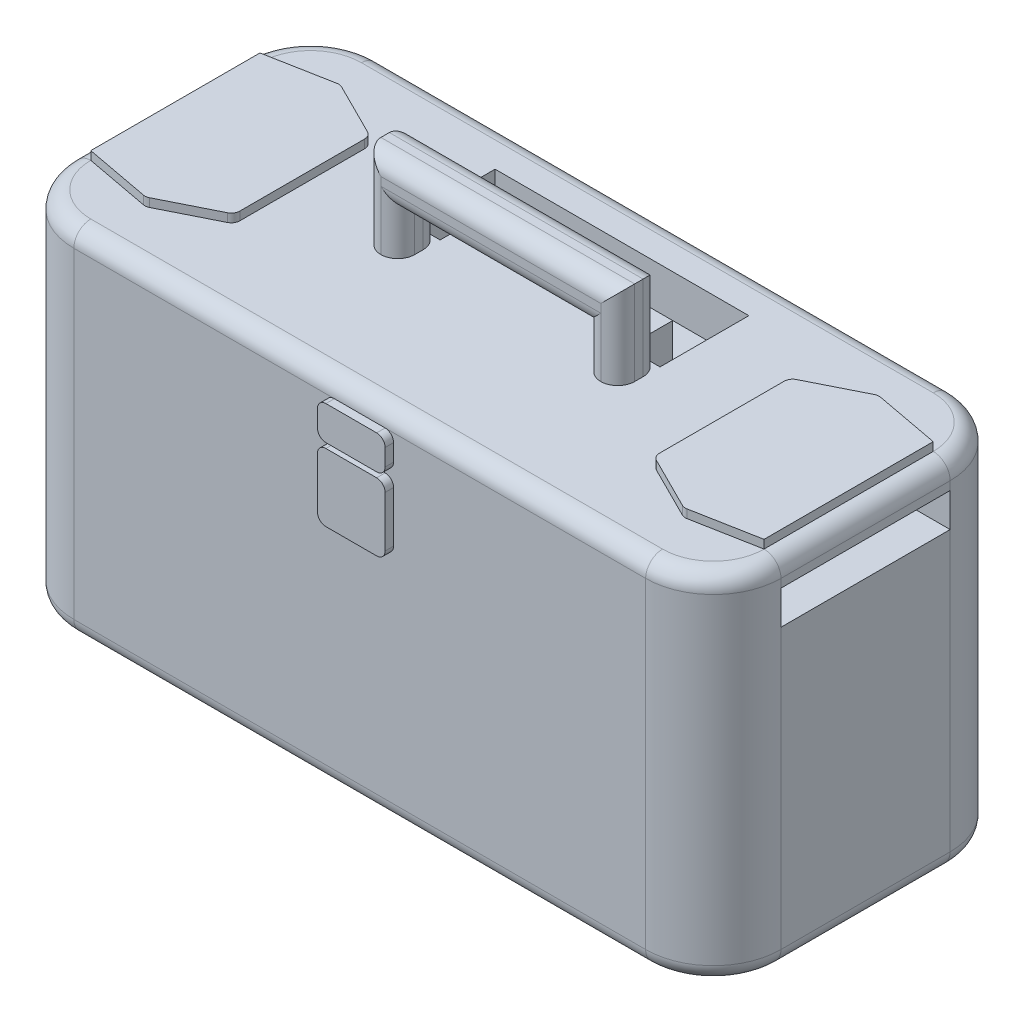
from build123d import *

# Parameters (mm, degrees)
SKIZZE1_W                       = 418
SKIZZE1_H                       = 210
AUFSATZ_LINEAR_AUSTRAGEN1_DEPTH = 90
VERRUNDUNG1_R                   = 40
SCHNITT_LINEAR_AUSTRAGEN1_DEPTH = 25
AUFSATZ_LINEAR_AUSTRAGEN2_DEPTH = 12.5
VERRUNDUNG2_R                   = 10
SKIZZE5_W                       = 100
SKIZZE5_H                       = 20
SCHNITT_LINEAR_AUSTRAGEN2_DEPTH = 20
SKIZZE6_W                       = 100
SKIZZE6_H                       = 20
SCHNITT_LINEAR_AUSTRAGEN3_DEPTH = 20
VERRUNDUNG4_R                   = 10
AUFSATZ_LINEAR_AUSTRAGEN3_DEPTH = 5
AUFSATZ_LINEAR_AUSTRAGEN4_DEPTH = 5


with BuildPart() as part:
    # Skizze1 → Aufsatz-Linear austragen1 (new, symmetric)
    with BuildSketch(Plane.XY):
        with Locations((0, 105)):
            Rectangle(SKIZZE1_W, SKIZZE1_H)
    extrude(amount=AUFSATZ_LINEAR_AUSTRAGEN1_DEPTH, both=True)

    # Verrundung1
    verrundung1_edges = [part.edges().sort_by_distance(p)[0] for p in [
        (209, 105, 90),
        (-209, 105, 90),
        (209, 105, -90),
        (-209, 105, -90),
    ]]
    fillet(verrundung1_edges, radius=VERRUNDUNG1_R)

    # Skizze3 → Schnitt-Linear austragen1 (cut)
    with BuildSketch(Plane(origin=(0, 210, 0), x_dir=(1, 0, 0), z_dir=(0, 1, 0))):
        Polygon((-75, -10), (-75, 65), (75, 65), (75, -10), (55, -10), (55, 40), (-55, 40), (-55, -10), align=None)
    extrude(amount=-SCHNITT_LINEAR_AUSTRAGEN1_DEPTH, mode=Mode.SUBTRACT)

    # Skizze4 → Aufsatz-Linear austragen2 (add, symmetric)
    with BuildSketch(Plane.XY):
        Polygon((-75, 185), (-75, 260), (75, 260), (75, 185), (55, 185), (55, 235), (-55, 235), (-55, 185), align=None)
    extrude(amount=AUFSATZ_LINEAR_AUSTRAGEN2_DEPTH, both=True)

    # Verrundung2
    verrundung2_edges = [part.edges().sort_by_distance(p)[0] for p in [
        (-75, 235, -12.5),
        (-55, 222.5, -12.5),
        (55, 222.5, -12.5),
        (0, 235, -12.5),
        (0, 260, -12.5),
        (75, 235, -12.5),
        (75, 235, 12.5),
        (55, 222.5, 12.5),
        (0, 260, 12.5),
        (0, 235, 12.5),
        (-55, 222.5, 12.5),
        (-75, 235, 12.5),
    ]]
    fillet(verrundung2_edges, radius=VERRUNDUNG2_R - 0.0001)  # a hair under: the kernel refuses the full size

    # Skizze5 → Schnitt-Linear austragen2 (cut)
    with BuildSketch(Plane(origin=(209, 0, 0), x_dir=(0, 0, -1), z_dir=(1, 0, 0))):
        with Locations((0, 185)):
            Rectangle(SKIZZE5_W, SKIZZE5_H)
    extrude(amount=-SCHNITT_LINEAR_AUSTRAGEN2_DEPTH, mode=Mode.SUBTRACT)

    # Skizze6 → Schnitt-Linear austragen3 (cut)
    with BuildSketch(Plane.ZY.offset(209)):
        with Locations((0, 185)):
            Rectangle(SKIZZE6_W, SKIZZE6_H)
    extrude(amount=-SCHNITT_LINEAR_AUSTRAGEN3_DEPTH, mode=Mode.SUBTRACT)

    # Verrundung4
    verrundung4_edges = [part.edges().sort_by_distance(p)[0] for p in [
        (0, 0, 90),
        (0, 210, 90),
        (0, 210, -90),
        (-209, 210, 0),
        (209, 210, 0),
        (-197.284271247, 210, 78.284271247),
        (-197.284271247, 210, -78.284271247),
        (197.284271247, 210, -78.284271247),
        (197.284271247, 210, 78.284271247),
        (209, 0, 0),
        (0, 0, -90),
        (-209, 0, 0),
        (-197.284271247, 0, 78.284271247),
        (-197.284271247, 0, -78.284271247),
        (197.284271247, 0, -78.284271247),
        (197.284271247, 0, 78.284271247),
    ]]
    fillet(verrundung4_edges, radius=VERRUNDUNG4_R)

    # Skizze7 → Aufsatz-Linear austragen3 (add)
    with BuildSketch(Plane(origin=(0, 210, 0), x_dir=(1, 0, 0), z_dir=(0, 1, 0))):
        with BuildLine():
            Line((-199, 50), (-160.65313505, 57.190037178))
            ThreePointArc((-160.65313505, 57.190037178), (-159.038186315, 57.227347612), (-157.495624397, 56.747812198))
            Line((-157.495624397, 56.747812198), (-126.763932023, 41.381966011))
            ThreePointArc((-126.763932023, 41.381966011), (-124.746745958, 39.538485617), (-124, 36.909830056))
            Line((-124, 36.909830056), (-124, -36.909830056))
            ThreePointArc((-124, -36.909830056), (-124.746745958, -39.538485617), (-126.763932023, -41.381966011))
            Line((-126.763932023, -41.381966011), (-157.495624397, -56.747812198))
            ThreePointArc((-157.495624397, -56.747812198), (-159.038186315, -57.227347612), (-160.65313505, -57.190037178))
            Line((-160.65313505, -57.190037178), (-199, -50))
            Line((-199, -50), (-199, 50))
        make_face()
        with BuildLine():
            Line((199, 50), (199, -50))
            Line((199, -50), (160.65313505, -57.190037178))
            ThreePointArc((160.65313505, -57.190037178), (159.038186315, -57.227347612), (157.495624397, -56.747812198))
            Line((157.495624397, -56.747812198), (126.763932023, -41.381966011))
            ThreePointArc((126.763932023, -41.381966011), (124.746745958, -39.538485617), (124, -36.909830056))
            Line((124, -36.909830056), (124, 36.909830056))
            ThreePointArc((124, 36.909830056), (124.746745958, 39.538485617), (126.763932023, 41.381966011))
            Line((126.763932023, 41.381966011), (157.495624397, 56.747812198))
            ThreePointArc((157.495624397, 56.747812198), (159.038186315, 57.227347612), (160.65313505, 57.190037178))
            Line((160.65313505, 57.190037178), (199, 50))
        make_face()
    extrude(amount=AUFSATZ_LINEAR_AUSTRAGEN3_DEPTH)

    # Skizze8 → Aufsatz-Linear austragen4 (add)
    with BuildSketch(Plane.XY.offset(90)):
        with BuildLine():
            Line((-15, 200), (15, 200))
            ThreePointArc((15, 200), (18.535533906, 198.535533906), (20, 195))
            Line((20, 195), (20, 185))
            ThreePointArc((20, 185), (18.535533906, 181.464466094), (15, 180))
            Line((15, 180), (-15, 180))
            ThreePointArc((-15, 180), (-18.535533906, 181.464466094), (-20, 185))
            Line((-20, 185), (-20, 195))
            ThreePointArc((-20, 195), (-18.535533906, 198.535533906), (-15, 200))
        make_face()
        with BuildLine():
            Line((-15, 177), (15, 177))
            ThreePointArc((15, 177), (18.535533906, 175.535533906), (20, 172))
            Line((20, 172), (20, 142))
            ThreePointArc((20, 142), (18.535533906, 138.464466094), (15, 137))
            Line((15, 137), (-15, 137))
            ThreePointArc((-15, 137), (-18.535533906, 138.464466094), (-20, 142))
            Line((-20, 142), (-20, 172))
            ThreePointArc((-20, 172), (-18.535533906, 175.535533906), (-15, 177))
        make_face()
    extrude(amount=AUFSATZ_LINEAR_AUSTRAGEN4_DEPTH)


solid = part.part
